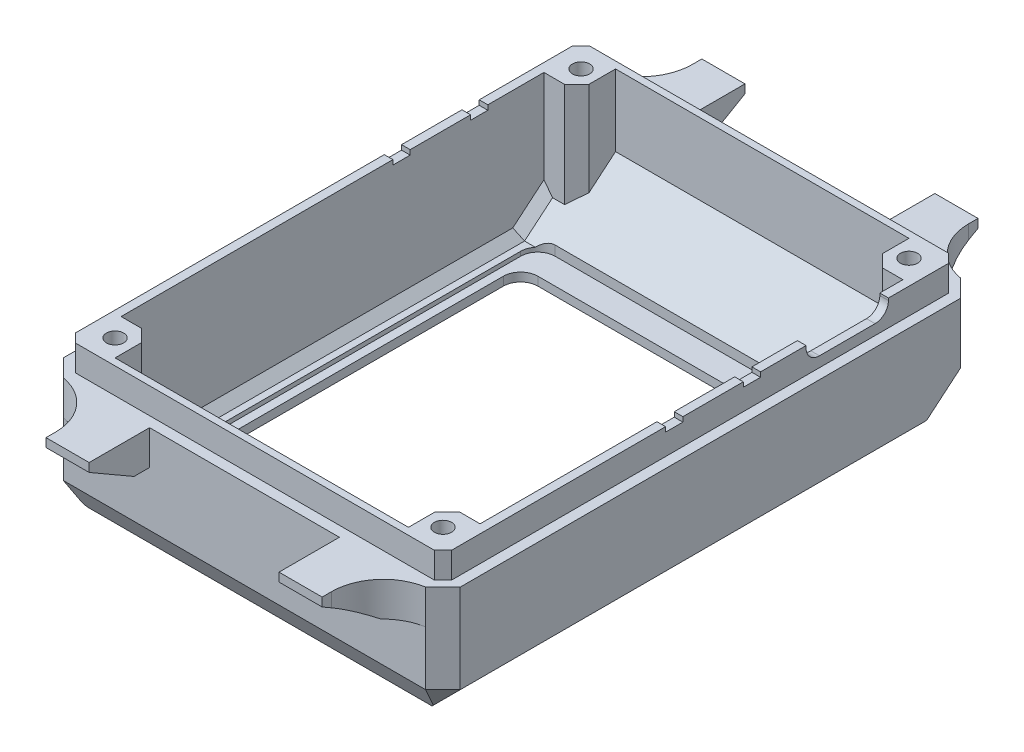
from build123d import *
from OCP.BRepFilletAPI import BRepFilletAPI_MakeChamfer

# Parameters (mm, degrees)
SKETCH1_W                           = 46
SKETCH1_H                           = 62
SKETCH1_W_2                         = 42
SKETCH1_H_2                         = 58
MAIN_SKETCH_DEPTH                   = 11.8
SKETCH2_W                           = 46
SKETCH2_H                           = 62
FLOOR_2_DEPTH                       = 1.5
CHAMFER_OUTER_CORNERS_SIZE          = 2
MATERIAL_FOR_HOLES_DEPTH            = 11.8
GLASS_HOLE_DEPTH                    = 5
GLASS_GLUING_SURFACE_DEPTH          = 0.5
CHAMFER_TOP_SIZE                    = 3
CHAMFER_TOP_SIZE2                   = 1.732050808
SKETCH21_R                          = 1
MOUNTING_HOLES_DEPTH                = 7
LOWER_START                         = 14.8
SKETCH22_R                          = 1
LOWER_TAB_DEPTH                     = 14.8
TYPE_C_CONNECTOR_DEPTH              = 10
SKETCH20_W                          = 5
SKETCH20_H                          = 4
STRAP_MOUNTS_DEPTH                  = 7
STRAP_CHAMFER_SIZE                  = 5.2
STRAP_CHAMFER_SIZE2                 = 3.0022214
STRAP_CHAMFER_OF_STRAP_MIRROR_SIZE  = 5.2
STRAP_CHAMFER_OF_STRAP_MIRROR_SIZE2 = 3.0022214
STRAP_FILLET_R                      = 6
SKETCH26_W                          = 2
SKETCH26_H                          = 0.54848205
BUTTON_CUTOUT_DEPTH                 = 10
SKETCH28_W                          = 2
SKETCH28_H                          = 0.55
CUT_EXTRUDE21_DEPTH                 = 1.8
CHAMFER7_START                      = -22
CHAMFER7_DEPTH                      = 44
CHAMFER7_2_DEPTH                    = 5
CHAMFER7_START_2                    = 17
CHAMFER7_3_DEPTH                    = 5
CHAMFER7_START_3                    = 4.8
CHAMFER7_4_OUTLINE_R                = 1
CHAMFER7_4_DEPTH                    = 2.2
CHAMFER7_5_DEPTH                    = 4.8
CHAMFER8_SIZE                       = 8
CHAMFER8_SIZE2                      = 9.534028741
CHAMFER11_SIZE                      = 1
CHAMFER12_SIZE                      = 3


with BuildPart() as part:
    # Sketch1 → Main sketch (new body)
    with BuildSketch(Plane(origin=(0, 0, 0), x_dir=(1, 0, 0), z_dir=(0, 1, 0))):
        Rectangle(SKETCH1_W, SKETCH1_H)
        Rectangle(SKETCH1_W_2, SKETCH1_H_2, mode=Mode.SUBTRACT)
    extrude(amount=MAIN_SKETCH_DEPTH)

    # Sketch2 → Floor 2 (add)
    with BuildSketch(Plane.XZ):
        Rectangle(SKETCH2_W, SKETCH2_H)
    extrude(amount=FLOOR_2_DEPTH)

    # Chamfer_Outer Corners
    chamfer_outer_corners_edges = [part.edges().sort_by_distance(p)[0] for p in [
        (-23, 5.15, -31),
        (23, 5.15, -31),
        (23, 5.15, 31),
        (-23, 5.15, 31),
    ]]
    chamfer(chamfer_outer_corners_edges, length=CHAMFER_OUTER_CORNERS_SIZE)

    # Sketch17 → Material for holes (add)
    with BuildSketch(Plane(origin=(0, 11.8, -8.5), x_dir=(1, 0, 0), z_dir=(0, -1, 0))):
        Polygon((18.414213562, 33), (21, 33), (21, 37.5), (17, 37.5), (17, 34.414213562), align=None)
        Polygon((18.414213562, -16), (17, -17.414213562), (17, -20.5), (21, -20.5), (21, -16), align=None)
        Polygon((-18.414213562, -16), (-21, -16), (-21, -20.5), (-17, -20.5), (-17, -17.414213562), align=None)
        Polygon((-18.414213562, 33), (-17, 34.414213562), (-17, 37.5), (-21, 37.5), (-21, 33), align=None)
    extrude(amount=MATERIAL_FOR_HOLES_DEPTH)

    # Sketch14 → Glass hole (cut)
    with BuildSketch(Plane(origin=(0, 0, 0), x_dir=(1, 0, 0), z_dir=(0, 1, 0))):
        with BuildLine():
            Line((16, -19), (-16, -19))
            ThreePointArc((-16, -19), (-17.414213562, -18.414213562), (-18, -17))
            Line((-18, -17), (-18, 17))
            ThreePointArc((-18, 17), (-17.414213562, 18.414213562), (-16, 19))
            Line((-16, 19), (16, 19))
            ThreePointArc((16, 19), (17.414213562, 18.414213562), (18, 17))
            Line((18, 17), (18, -17))
            ThreePointArc((18, -17), (17.414213562, -18.414213562), (16, -19))
        make_face()
    extrude(amount=-GLASS_HOLE_DEPTH, mode=Mode.SUBTRACT)

    # Sketch11 → Glass gluing surface (cut)
    with BuildSketch(Plane(origin=(0, 0, 0), x_dir=(1, 0, 0), z_dir=(0, 1, 0))):
        with BuildLine():
            Line((17, -22), (-17, -22))
            ThreePointArc((-17, -22), (-18.414213562, -21.414213562), (-19, -20))
            Line((-19, -20), (-19, 20))
            ThreePointArc((-19, 20), (-18.414213562, 21.414213562), (-17, 22))
            Line((-17, 22), (17, 22))
            ThreePointArc((17, 22), (18.414213562, 21.414213562), (19, 20))
            Line((19, 20), (19, -20))
            ThreePointArc((19, -20), (18.414213562, -21.414213562), (17, -22))
        make_face()
    extrude(amount=-GLASS_GLUING_SURFACE_DEPTH, mode=Mode.SUBTRACT)

    # Chamfer_ top: one chamfer whose edges measure the first distance from different faces: ONE call of the kernel's chamfer builder (chamfer() names one face for all edges)
    chamfer_top_edges_1 = [part.edges().sort_by_distance(p)[0] for p in [
        (0, -1.5, 31),
    ]]
    chamfer_top_side_1 = [part.faces().sort_by_distance(p)[0] for p in [
        (0, 5.15, 31),
    ]]
    chamfer_top_edges_2 = [part.edges().sort_by_distance(p)[0] for p in [
        (22, -1.5, 30),
    ]]
    chamfer_top_side_2 = [part.faces().sort_by_distance(p)[0] for p in [
        (22, 5.15, 30),
    ]]
    chamfer_top_edges_3 = [part.edges().sort_by_distance(p)[0] for p in [
        (-22, -1.5, 30),
    ]]
    chamfer_top_side_3 = [part.faces().sort_by_distance(p)[0] for p in [
        (-22, 5.15, 30),
    ]]
    chamfer_top = BRepFilletAPI_MakeChamfer(part.part.solid().wrapped)
    for e in chamfer_top_edges_1:
        chamfer_top.Add(CHAMFER_TOP_SIZE, CHAMFER_TOP_SIZE2, e.wrapped, chamfer_top_side_1[0].wrapped)  # the first distance lies on this face
    for e in chamfer_top_edges_2:
        chamfer_top.Add(CHAMFER_TOP_SIZE, CHAMFER_TOP_SIZE2, e.wrapped, chamfer_top_side_2[0].wrapped)  # the first distance lies on this face
    for e in chamfer_top_edges_3:
        chamfer_top.Add(CHAMFER_TOP_SIZE, CHAMFER_TOP_SIZE2, e.wrapped, chamfer_top_side_3[0].wrapped)  # the first distance lies on this face
    add(Compound.cast(chamfer_top.Shape()), mode=Mode.REPLACE)

    # Sketch21 → Mounting Holes (cut)
    with BuildSketch(Plane(origin=(0, 11.8, 0), x_dir=(1, 0, 0), z_dir=(0, 1, 0))):
        with Locations(Location((19, -27, 0), (0, 0, 270))):
            Circle(SKETCH21_R)
        with Locations(Location((-19, -27, 0), (0, 0, 90))):
            Circle(SKETCH21_R)
        with Locations(Location((-19, 27, 0), (0, 0, 270))):
            Circle(SKETCH21_R)
        with Locations(Location((19, 27, 0), (0, 0, 90))):
            Circle(SKETCH21_R)
    extrude(amount=-MOUNTING_HOLES_DEPTH, mode=Mode.SUBTRACT)

    # Sketch22 → Lower Tab (add)
    with BuildSketch(Plane(origin=(0, 0, 0), x_dir=(1, 0, 0), z_dir=(0, 1, 0)).offset(LOWER_START)):
        Polygon((20.8, 29.8), (-20.8, 29.8), (-21.8, 28.8), (-21.8, -28.8), (-20.8, -29.8), (20.8, -29.8), (21.8, -28.8), (21.8, 28.8), align=None)
        with Locations(Location((-19, -27, 0), (0, 0, 270))):
            Circle(SKETCH22_R, mode=Mode.SUBTRACT)
        with Locations(Location((19, -27, 0), (0, 0, 270))):
            Circle(SKETCH22_R, mode=Mode.SUBTRACT)
        with Locations(Location((-19, 27, 0), (0, 0, 270))):
            Circle(SKETCH22_R, mode=Mode.SUBTRACT)
        with Locations(Location((19, 27, 0), (0, 0, 270))):
            Circle(SKETCH22_R, mode=Mode.SUBTRACT)
        Polygon((-20.8, -24.5), (-18.414213562, -24.5), (-17, -25.914213562), (-17, -29), (17, -29), (17, -25.914213562), (18.414213562, -24.5), (20.8, -24.5), (20.8, 24.5), (18.414213562, 24.5), (17, 25.914213562), (17, 29), (-17, 29), (-17, 25.914213562), (-18.414213562, 24.5), (-20.8, 24.5), align=None, mode=Mode.SUBTRACT)
    extrude(amount=-LOWER_TAB_DEPTH)

    # Sketch24 → Type C Connector (cut)
    with BuildSketch(Plane(origin=(21.8, 0, -8), x_dir=(0, 0, 1), z_dir=(-1, 0, 0))):
        with BuildLine():
            Line((-13.823605705, 14.8), (-4.273605705, 14.8))
            Line((-4.273605705, 14.8), (-4.273605705, 14.55))
            ThreePointArc((-4.273605705, 14.55), (-4.727590194, 13.453984489), (-5.823605705, 13))
            Line((-5.823605705, 13), (-12.273605705, 13))
            ThreePointArc((-12.273605705, 13), (-13.369621216, 13.453984489), (-13.823605705, 14.55))
            Line((-13.823605705, 14.55), (-13.823605705, 14.8))
        make_face()
    extrude(amount=TYPE_C_CONNECTOR_DEPTH, mode=Mode.SUBTRACT)

    # Sketch20 → Strap Mounts (add)
    with BuildSketch(Plane.XY.offset(31)):
        with Locations((13.5, 9.8)):
            Rectangle(SKETCH20_W, SKETCH20_H)
        with Locations((-13.5, 9.8)):
            Rectangle(SKETCH20_W, SKETCH20_H)
    strap_mounts = extrude(amount=STRAP_MOUNTS_DEPTH)

    # Strap Chamfer: one chamfer whose edges measure the first distance from different faces: ONE call of the kernel's chamfer builder (chamfer() names one face for all edges)
    strap_chamfer_edges_1 = [part.edges().sort_by_distance(p)[0] for p in [
        (13.5, 7.8, 38),
    ]]
    strap_chamfer_side_1 = [part.faces().sort_by_distance(p)[0] for p in [
        (13.5, 7.8, 34.5),
    ]]
    strap_chamfer_edges_2 = [part.edges().sort_by_distance(p)[0] for p in [
        (-13.5, 7.8, 38),
    ]]
    strap_chamfer_side_2 = [part.faces().sort_by_distance(p)[0] for p in [
        (-13.5, 7.8, 34.5),
    ]]
    strap_chamfer = BRepFilletAPI_MakeChamfer(part.part.solid().wrapped)
    for e in strap_chamfer_edges_1:
        strap_chamfer.Add(STRAP_CHAMFER_SIZE, STRAP_CHAMFER_SIZE2, e.wrapped, strap_chamfer_side_1[0].wrapped)  # the first distance lies on this face
    for e in strap_chamfer_edges_2:
        strap_chamfer.Add(STRAP_CHAMFER_SIZE, STRAP_CHAMFER_SIZE2, e.wrapped, strap_chamfer_side_2[0].wrapped)  # the first distance lies on this face
    add(Compound.cast(strap_chamfer.Shape()), mode=Mode.REPLACE)

    # Strap Mirror: Strap Mounts across plane
    add(strap_mounts.mirror(Plane.XY))

    # Strap Chamfer of Strap Mirror: one chamfer whose edges measure the first distance from different faces: ONE call of the kernel's chamfer builder (chamfer() names one face for all edges)
    strap_chamfer_of_strap_mirror_edges_1 = [part.edges().sort_by_distance(p)[0] for p in [
        (13.5, 7.8, -38),
    ]]
    strap_chamfer_of_strap_mirror_side_1 = [part.faces().sort_by_distance(p)[0] for p in [
        (13.5, 7.8, -34.5),
    ]]
    strap_chamfer_of_strap_mirror_edges_2 = [part.edges().sort_by_distance(p)[0] for p in [
        (-13.5, 7.8, -38),
    ]]
    strap_chamfer_of_strap_mirror_side_2 = [part.faces().sort_by_distance(p)[0] for p in [
        (-13.5, 7.8, -34.5),
    ]]
    strap_chamfer_of_strap_mirror = BRepFilletAPI_MakeChamfer(part.part.solid().wrapped)
    for e in strap_chamfer_of_strap_mirror_edges_1:
        strap_chamfer_of_strap_mirror.Add(STRAP_CHAMFER_OF_STRAP_MIRROR_SIZE, STRAP_CHAMFER_OF_STRAP_MIRROR_SIZE2, e.wrapped, strap_chamfer_of_strap_mirror_side_1[0].wrapped)  # the first distance lies on this face
    for e in strap_chamfer_of_strap_mirror_edges_2:
        strap_chamfer_of_strap_mirror.Add(STRAP_CHAMFER_OF_STRAP_MIRROR_SIZE, STRAP_CHAMFER_OF_STRAP_MIRROR_SIZE2, e.wrapped, strap_chamfer_of_strap_mirror_side_2[0].wrapped)  # the first distance lies on this face
    add(Compound.cast(strap_chamfer_of_strap_mirror.Shape()), mode=Mode.REPLACE)

    # Strap Fillet
    # the kernel refuses this fillet: 6 mm, written as the material it adds along each edge
    with BuildSketch(Plane(origin=(16, 11.8, 31), x_dir=(1, 0, 0), z_dir=(0, -1, 0))) as strap_fillet_piece_1_section:
        with BuildLine():
            CenterArc((6, 5.916079783), STRAP_FILLET_R, 180, 80.405931773)
            Line((0, 5.916079783), (0, 0))
            Line((0, 0), (5, 0))
        make_face()
    strap_fillet_piece_1 = extrude(amount=4, mode=Mode.PRIVATE)
    strap_fillet_piece_1 = split(strap_fillet_piece_1, bisect_by=Plane(origin=(16, 8.020577137, 33.182050808), z_dir=(0, 0.8660254037844382, -0.5000000000000009)), keep=Keep.TOP, mode=Mode.PRIVATE)
    add(strap_fillet_piece_1)
    with BuildSketch(Plane(origin=(-16, 11.8, 31), x_dir=(-1, 0, 0), z_dir=(0, -1, 0))) as strap_fillet_piece_2_section:
        with BuildLine():
            CenterArc((6, -5.916079783), STRAP_FILLET_R, 99.594068227, 80.405931773)
            Line((0, -5.916079783), (0, 0))
            Line((0, 0), (5, 0))
        make_face()
    strap_fillet_piece_2 = extrude(amount=4, mode=Mode.PRIVATE)
    strap_fillet_piece_2 = split(strap_fillet_piece_2, bisect_by=Plane(origin=(-16, 8.020577137, 33.182050808), z_dir=(0, 0.8660254037844382, -0.5000000000000009)), keep=Keep.TOP, mode=Mode.PRIVATE)
    add(strap_fillet_piece_2)
    with BuildSketch(Plane(origin=(16, 11.8, -31), x_dir=(0, 0, -1), z_dir=(0, -1, 0))) as strap_fillet_piece_3_section:
        with BuildLine():
            CenterArc((5.916079783, 6), STRAP_FILLET_R, 189.594068227, 80.405931773)
            Line((0, 5), (0, 0))
            Line((0, 0), (5.916079783, 0))
        make_face()
    strap_fillet_piece_3 = extrude(amount=4, mode=Mode.PRIVATE)
    strap_fillet_piece_3 = split(strap_fillet_piece_3, bisect_by=Plane(origin=(16, 8.020577137, -33.182050808), z_dir=(0, 0.8660254037844382, 0.5000000000000009)), keep=Keep.TOP, mode=Mode.PRIVATE)
    add(strap_fillet_piece_3)
    with BuildSketch(Plane(origin=(-16, 11.8, -31), x_dir=(-1, 0, 0), z_dir=(0, -1, 0))) as strap_fillet_piece_4_section:
        with BuildLine():
            CenterArc((6, 5.916079783), STRAP_FILLET_R, 180, 80.405931773)
            Line((0, 5.916079783), (0, 0))
            Line((0, 0), (5, 0))
        make_face()
    strap_fillet_piece_4 = extrude(amount=4, mode=Mode.PRIVATE)
    strap_fillet_piece_4 = split(strap_fillet_piece_4, bisect_by=Plane(origin=(-16, 8.020577137, -33.182050808), z_dir=(0, 0.8660254037844382, 0.5000000000000009)), keep=Keep.TOP, mode=Mode.PRIVATE)
    add(strap_fillet_piece_4)

    # Sketch26 → Button_Cutout (cut)
    with BuildSketch(Plane(origin=(21.8, 0, 0), x_dir=(0, 0, -1), z_dir=(1, 0, 0))):
        with Locations((6.001655918, 14.525758975)):
            Rectangle(SKETCH26_W, SKETCH26_H)
        with Locations((-2.998344082, 14.525758975)):
            Rectangle(SKETCH26_W, SKETCH26_H)
    extrude(amount=-BUTTON_CUTOUT_DEPTH, mode=Mode.SUBTRACT)

    # Sketch28 → Cut-Extrude21 (cut)
    with BuildSketch(Plane.ZY.offset(21.8)):
        with Locations((-8, 14.525)):
            Rectangle(SKETCH28_W, SKETCH28_H)
        with Locations((-17, 14.525)):
            Rectangle(SKETCH28_W, SKETCH28_H)
    extrude(amount=-CUT_EXTRUDE21_DEPTH, mode=Mode.SUBTRACT)

    # Chamfer7: read off the stored shape, not the designer's step
    # Chamfer7 outline → Chamfer7 (add)
    with BuildSketch(Plane.YZ.offset(CHAMFER7_START)):
        Polygon((0.626302582, -22), (0, -22), (0, -29), (6.5, -29), align=None)
    extrude(amount=CHAMFER7_DEPTH)

    # Chamfer7 2 outline → Chamfer7 2 (add)
    with BuildSketch(Plane.YZ.offset(CHAMFER7_START)):
        Polygon((0, -21.253601648), (0, -22), (0.626302582, -22), align=None)
    extrude(amount=CHAMFER7_2_DEPTH)

    # Chamfer7 3 outline → Chamfer7 3 (add)
    with BuildSketch(Plane.YZ.offset(CHAMFER7_START_2)):
        Polygon((0, -21.253601648), (0, -22), (0.626302582, -22), align=None)
    extrude(amount=CHAMFER7_3_DEPTH)

    # Chamfer7 4 outline → Chamfer7 4 (cut)
    with BuildSketch(Plane(origin=(0, 0, 0), x_dir=(1, 0, 0), z_dir=(0, 1, 0)).offset(CHAMFER7_START_3)):
        with Locations((-19, 27)):
            Circle(CHAMFER7_4_OUTLINE_R)
        with Locations((19, 27)):
            Circle(CHAMFER7_4_OUTLINE_R)
    extrude(amount=CHAMFER7_4_DEPTH, mode=Mode.SUBTRACT)

    # Chamfer7 5 outline → Chamfer7 5 (cut)
    with BuildSketch(Plane(origin=(0, 0, 0), x_dir=(1, 0, 0), z_dir=(0, 1, 0))):
        with BuildLine():
            Line((17, 22), (17, 21.253601648))
            Line((17, 21.253601648), (18.558359043, 21.253601648))
            ThreePointArc((18.558359043, 21.253601648), (17.863943489, 21.803774279), (17, 22))
        make_face()
        with BuildLine():
            ThreePointArc((-17, 22), (-17.863943489, 21.803774279), (-18.558359043, 21.253601648))
            Line((-18.558359043, 21.253601648), (-17, 21.253601648))
            Line((-17, 21.253601648), (-17, 22))
        make_face()
    extrude(amount=CHAMFER7_5_DEPTH, mode=Mode.SUBTRACT)

    # Chamfer8
    chamfer8_edges = [part.edges().sort_by_distance(p)[0] for p in [
        (0, -1.5, -31),
    ]]
    chamfer8_side = [part.faces().sort_by_distance(p)[0] for p in [
        (0, 4.372732971, -31),
    ]]
    chamfer(chamfer8_edges, length=CHAMFER8_SIZE, length2=CHAMFER8_SIZE2, reference=chamfer8_side[0])

    # Chamfer11
    chamfer11_edges = [part.edges().sort_by_distance(p)[0] for p in [
        (20.8, 0, 1.623199176),
        (-20.8, 0, 1.623199176),
        (-20.8, 1.675177121, -23.25),
        (20.8, 1.675177121, -23.25),
    ]]
    chamfer(chamfer11_edges, length=CHAMFER11_SIZE)

    # Chamfer12
    chamfer12_edges = [part.edges().sort_by_distance(p)[0] for p in [
        (-23, -1.5, 2.542269499),
        (23, -1.5, 2.542269499),
    ]]
    chamfer(chamfer12_edges, length=CHAMFER12_SIZE)


solid = part.part
